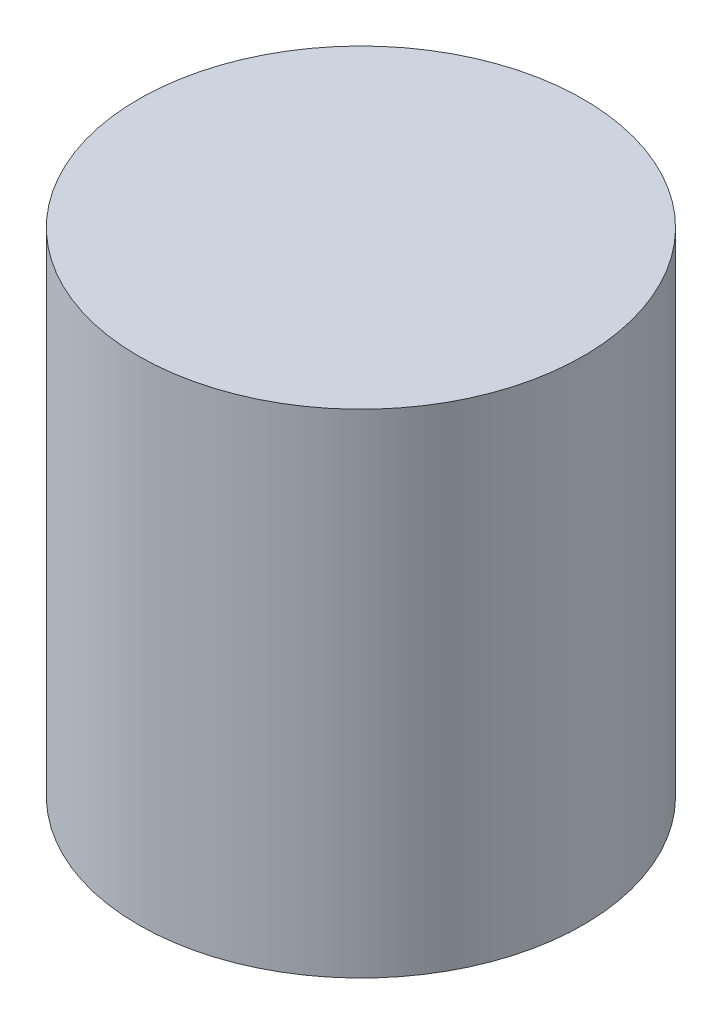
from build123d import *

# Parameters (mm, degrees)
SKETCH1_R           = 14
BOSS_EXTRUDE1_DEPTH = 15.5


with BuildPart() as part:
    # Sketch1 → Boss-Extrude1 (new, symmetric)
    with BuildSketch(Plane(origin=(0, 0, 0), x_dir=(1, 0, 0), z_dir=(0, 1, 0))):
        Circle(SKETCH1_R)
    extrude(amount=BOSS_EXTRUDE1_DEPTH, both=True)


solid = part.part
